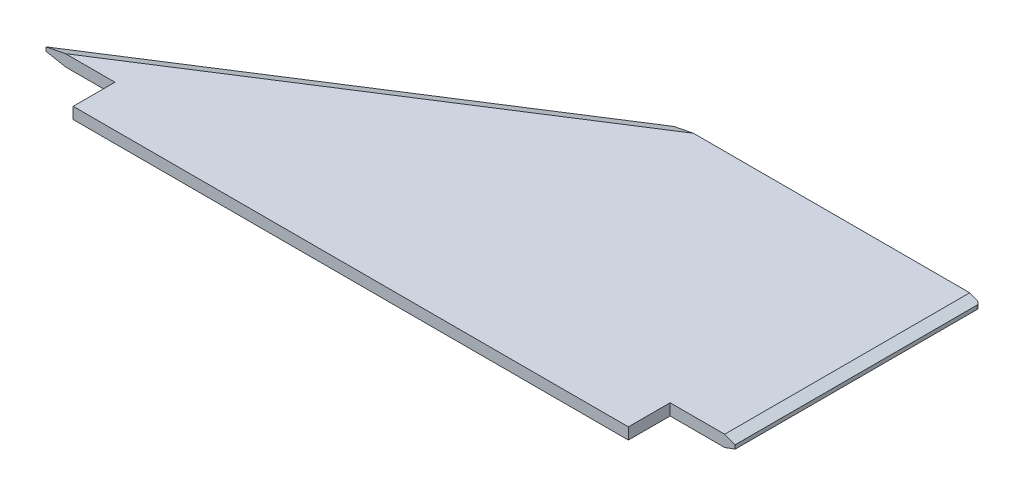
from build123d import *
from OCP.BRepFilletAPI import BRepFilletAPI_MakeChamfer

# Parameters (mm, degrees)
BOSS_EXTRUDE1_DEPTH = 3
CHAMFER1_SIZE       = 1
CHAMFER1_SIZE2      = 2.747477419
CHAMFER2_SIZE       = 1
CHAMFER2_SIZE2      = 2.747477419
FILLET1_R           = 1


with BuildPart() as part:
    # Sketch1 → Boss-Extrude1 (new body)
    with BuildSketch(Plane(origin=(0, 0, 0), x_dir=(1, 0, 0), z_dir=(0, 1, 0))):
        Polygon((0, 10.9), (100, 74.9), (180, 74.9), (180, 10.9), (163, 10.9), (163, 0), (18, 0), (18, 10.9), align=None)
    extrude(amount=BOSS_EXTRUDE1_DEPTH)

    # Chamfer1: one chamfer whose edges measure the first distance from different faces: ONE call of the kernel's chamfer builder (chamfer() names one face for all edges)
    chamfer1_edges_1 = [part.edges().sort_by_distance(p)[0] for p in [
        (180, 3, -42.9),
    ]]
    chamfer1_side_1 = [part.faces().sort_by_distance(p)[0] for p in [
        (180, 1.5, -42.9),
    ]]
    chamfer1_edges_2 = [part.edges().sort_by_distance(p)[0] for p in [
        (50, 3, -42.9),
    ]]
    chamfer1_side_2 = [part.faces().sort_by_distance(p)[0] for p in [
        (50, 1.5, -42.9),
    ]]
    chamfer1 = BRepFilletAPI_MakeChamfer(part.part.solid().wrapped)
    for e in chamfer1_edges_1:
        chamfer1.Add(CHAMFER1_SIZE, CHAMFER1_SIZE2, e.wrapped, chamfer1_side_1[0].wrapped)  # the first distance lies on this face
    for e in chamfer1_edges_2:
        chamfer1.Add(CHAMFER1_SIZE, CHAMFER1_SIZE2, e.wrapped, chamfer1_side_2[0].wrapped)  # the first distance lies on this face
    add(Compound.cast(chamfer1.Shape()), mode=Mode.REPLACE)

    # Chamfer2: one chamfer whose edges measure the first distance from different faces: ONE call of the kernel's chamfer builder (chamfer() names one face for all edges)
    chamfer2_edges_1 = [part.edges().sort_by_distance(p)[0] for p in [
        (50, 0, -42.9),
    ]]
    chamfer2_side_1 = [part.faces().sort_by_distance(p)[0] for p in [
        (50, 1, -42.9),
    ]]
    chamfer2_edges_2 = [part.edges().sort_by_distance(p)[0] for p in [
        (180, 0, -42.9),
    ]]
    chamfer2_side_2 = [part.faces().sort_by_distance(p)[0] for p in [
        (180, 1, -42.9),
    ]]
    chamfer2 = BRepFilletAPI_MakeChamfer(part.part.solid().wrapped)
    for e in chamfer2_edges_1:
        chamfer2.Add(CHAMFER2_SIZE, CHAMFER2_SIZE2, e.wrapped, chamfer2_side_1[0].wrapped)  # the first distance lies on this face
    for e in chamfer2_edges_2:
        chamfer2.Add(CHAMFER2_SIZE, CHAMFER2_SIZE2, e.wrapped, chamfer2_side_2[0].wrapped)  # the first distance lies on this face
    add(Compound.cast(chamfer2.Shape()), mode=Mode.REPLACE)

    # Fillet1
    fillet1_edges = [part.edges().sort_by_distance(p)[0] for p in [
        (180, 1.5, -74.9),
    ]]
    fillet(fillet1_edges, radius=FILLET1_R)


solid = part.part
